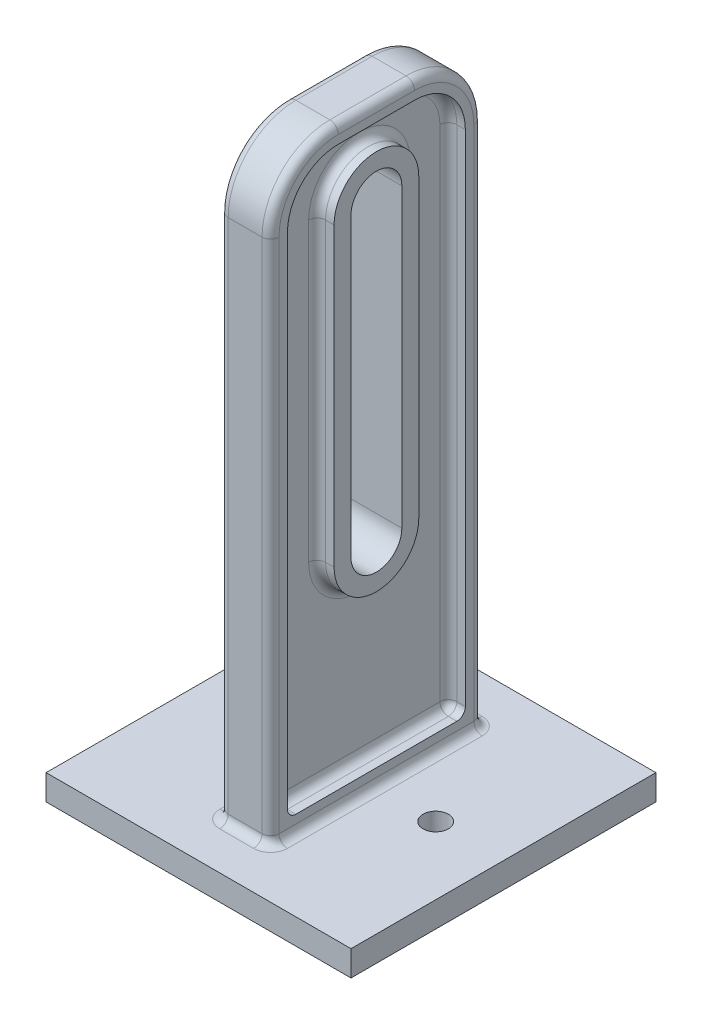
from build123d import *

# Parameters (mm, degrees)
SKETCH1_W           = 36
SKETCH1_H           = 36
BOSS_EXTRUDE1_DEPTH = 3
SKETCH2_R           = 1.5
CUT_EXTRUDE1_DEPTH  = 3
SKETCH3_W           = 6
SKETCH3_H           = 25
BOSS_EXTRUDE2_DEPTH = 70
CUT_EXTRUDE2_DEPTH  = 70
FILLET1_R           = 8
FILLET2_R           = 8
CUT_EXTRUDE3_DEPTH  = 2
FILLET3_R           = 1
FILLET4_R           = 1
FILLET5_R           = 1
FILLET6_R           = 1
FILLET7_R           = 1
FILLET8_R           = 1
FILLET9_R           = 1


with BuildPart() as part:
    # Sketch1 → Boss-Extrude1 (new body)
    with BuildSketch(Plane(origin=(0, 0, 0), x_dir=(1, 0, 0), z_dir=(0, 1, 0))):
        Rectangle(SKETCH1_W, SKETCH1_H)
    extrude(amount=BOSS_EXTRUDE1_DEPTH)

    # Sketch2 → Cut-Extrude1 (cut)
    with BuildSketch(Plane(origin=(0, 3, 0), x_dir=(1, 0, 0), z_dir=(0, 1, 0))):
        with Locations(Location((-10, 0, 0), (0, 0, 270))):
            Circle(SKETCH2_R)
        with Locations(Location((10, 0, 0), (0, 0, 270))):
            Circle(SKETCH2_R)
    extrude(amount=-CUT_EXTRUDE1_DEPTH, mode=Mode.SUBTRACT)

    # Sketch3 → Boss-Extrude2 (add)
    with BuildSketch(Plane(origin=(0, 3, 0), x_dir=(1, 0, 0), z_dir=(0, 1, 0))):
        Rectangle(SKETCH3_W, SKETCH3_H)
    extrude(amount=BOSS_EXTRUDE2_DEPTH)

    # Sketch4 → Cut-Extrude2 (cut)
    with BuildSketch(Plane(origin=(3, 0, 0), x_dir=(0, 0, -1), z_dir=(1, 0, 0))):
        with BuildLine():
            Line((3, 63), (3, 28))
            ThreePointArc((3, 28), (0, 25), (-3, 28))
            Line((-3, 28), (-3, 63))
            ThreePointArc((-3, 63), (0, 66), (3, 63))
        make_face()
    extrude(amount=-CUT_EXTRUDE2_DEPTH, mode=Mode.SUBTRACT)

    # Fillet1
    fillet1_edges = [part.edges().sort_by_distance(p)[0] for p in [
        (0, 73, 12.5),
    ]]
    fillet(fillet1_edges, radius=FILLET1_R)

    # Fillet2
    fillet2_edges = [part.edges().sort_by_distance(p)[0] for p in [
        (0, 73, -12.5),
    ]]
    fillet(fillet2_edges, radius=FILLET2_R)

    # Sketch5 → Cut-Extrude3 (cut)
    with BuildSketch(Plane(origin=(3, 0, 0), x_dir=(0, 0, -1), z_dir=(1, 0, 0))):
        with BuildLine():
            Line((-10.5, 5), (10.5, 5))
            Line((10.5, 5), (10.5, 65))
            ThreePointArc((10.5, 65), (8.742640687, 69.242640687), (4.5, 71))
            Line((4.5, 71), (-4.5, 71))
            ThreePointArc((-4.5, 71), (-8.742640687, 69.242640687), (-10.5, 65))
            Line((-10.5, 65), (-10.5, 5))
        make_face()
        with BuildLine():
            Line((5, 28), (5, 63))
            ThreePointArc((5, 63), (0, 68), (-5, 63))
            Line((-5, 63), (-5, 28))
            ThreePointArc((-5, 28), (0, 23), (5, 28))
        make_face(mode=Mode.SUBTRACT)
    cut_extrude3 = extrude(amount=-CUT_EXTRUDE3_DEPTH, mode=Mode.SUBTRACT)

    # Mirror1: Cut-Extrude3 across plane
    add(cut_extrude3.mirror(Plane(origin=(0, 0, 0), x_dir=(0, 0, 1), z_dir=(1, 0, 0))), mode=Mode.SUBTRACT)

    # Fillet3
    fillet3_edges = [part.edges().sort_by_distance(p)[0] for p in [
        (1, 45.5, 5),
        (1, 23, 0),
        (1, 45.5, -5),
        (1, 68, 0),
    ]]
    fillet(fillet3_edges, radius=FILLET3_R)

    # Fillet4
    fillet4_edges = [part.edges().sort_by_distance(p)[0] for p in [
        (1, 35, 10.5),
        (1, 69.242640687, 8.742640687),
        (1, 71, 0),
        (1, 69.242640687, -8.742640687),
        (1, 35, -10.5),
        (1, 5, 0),
    ]]
    fillet(fillet4_edges, radius=FILLET4_R)

    # Fillet5
    # the kernel refuses this fillet: 1 mm, written as the material it adds along each edge
    with BuildSketch(Plane(origin=(2, 6, 9.5), x_dir=(0, 0, 1), z_dir=(0, -1, 0))) as fillet5_piece_1_section:
        Polygon((0, 0), (FILLET5_R, 0), (FILLET5_R, FILLET5_R), (0, FILLET5_R), align=None)
    fillet5_piece_1 = extrude(amount=FILLET5_R, mode=Mode.PRIVATE)
    fillet5_piece_1 = fillet5_piece_1 - Plane(origin=(2, 6, 9.5), x_dir=(0.7071067811865474, 0, -0.7071067811865477), z_dir=(0, -1, 0)) * Sphere(FILLET5_R, mode=Mode.PRIVATE)
    add(fillet5_piece_1)
    with BuildSketch(Plane(origin=(3, 5, 10.5), x_dir=(0, 0, -1), z_dir=(-1, 0, 0))) as fillet5_piece_2:
        with BuildLine():
            CenterArc((FILLET5_R, -FILLET5_R), FILLET5_R, 90, 90)
            Line((0, -FILLET5_R), (0, 0))
            Line((0, 0), (FILLET5_R, 0))
        make_face()
    extrude(amount=1)

    # Fillet6
    # the kernel refuses this fillet: 1 mm, written as the material it adds along each edge
    with BuildSketch(Plane(origin=(2, 6, -9.5), x_dir=(0, 0, -1), z_dir=(0, -1, 0))) as fillet6_piece_1_section:
        Polygon((0, 0), (FILLET6_R, 0), (FILLET6_R, -FILLET6_R), (0, -FILLET6_R), align=None)
    fillet6_piece_1 = extrude(amount=FILLET6_R, mode=Mode.PRIVATE)
    fillet6_piece_1 = fillet6_piece_1 - Plane(origin=(2, 6, -9.5), x_dir=(0.7071067811865477, 0, 0.7071067811865474), z_dir=(0, -1, 0)) * Sphere(FILLET6_R, mode=Mode.PRIVATE)
    add(fillet6_piece_1)
    with BuildSketch(Plane(origin=(3, 5, -10.5), x_dir=(0, 0, 1), z_dir=(-1, 0, 0))) as fillet6_piece_2:
        with BuildLine():
            CenterArc((FILLET6_R, FILLET6_R), FILLET6_R, 180, 90)
            Line((0, FILLET6_R), (0, 0))
            Line((0, 0), (FILLET6_R, 0))
        make_face()
    extrude(amount=1)

    # Fillet7
    fillet7_edges = [part.edges().sort_by_distance(p)[0] for p in [
        (-1, 23, 0),
        (-1, 45.5, -5),
        (-1, 68, 0),
        (-1, 45.5, 5),
    ]]
    fillet(fillet7_edges, radius=FILLET7_R)

    # Fillet8
    fillet8_edges = [part.edges().sort_by_distance(p)[0] for p in [
        (-1, 35, 10.5),
        (-1, 5, 0),
        (-1, 35, -10.5),
        (-1, 69.242640687, -8.742640687),
        (-1, 71, 0),
        (-1, 69.242640687, 8.742640687),
        (-2, 5, 10.5),
        (-2, 5, -10.5),
    ]]
    fillet(fillet8_edges, radius=FILLET8_R)

    # Fillet9
    fillet9_edges = [part.edges().sort_by_distance(p)[0] for p in [
        (3, 3, 0),
        (0, 3, -12.5),
        (-3, 3, 0),
        (0, 3, 12.5),
        (3, 73, 0),
        (3, 34, 12.5),
        (3, 70.656854249, 10.156854249),
        (-3, 34, 12.5),
        (-3, 70.656854249, 10.156854249),
        (-3, 73, 0),
        (-3, 34, -12.5),
        (-3, 70.656854249, -10.156854249),
        (3, 34, -12.5),
        (3, 70.656854249, -10.156854249),
    ]]
    fillet(fillet9_edges, radius=FILLET9_R)


solid = part.part
